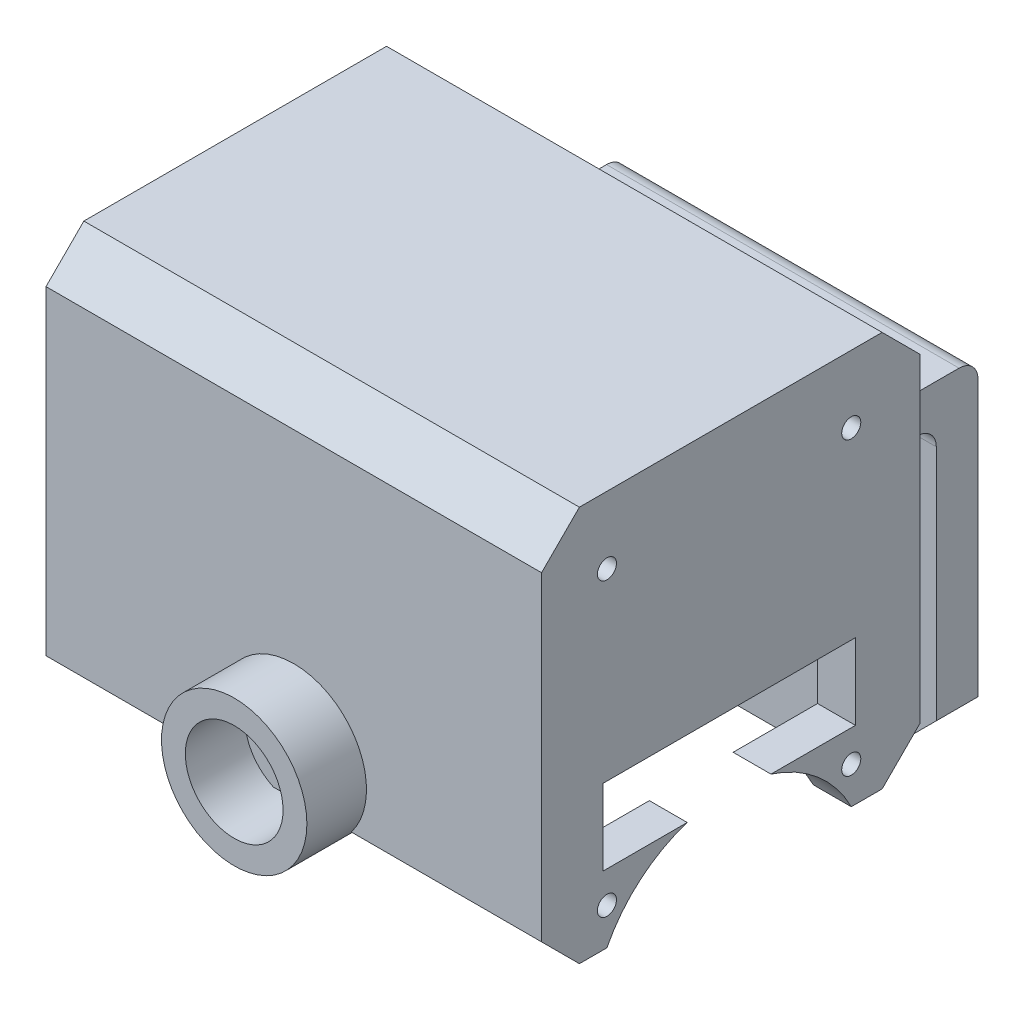
from build123d import *

# Parameters (mm, degrees)
SKETCH1_W                       = 25
SKETCH1_H                       = 30
BOSS_EXTRUDE1_DEPTH             = 3.175
SKETCH2_W                       = 25
SKETCH2_H                       = 3.175
BOSS_EXTRUDE2_DEPTH             = 41.58
SKETCH3_W                       = 3.175
SKETCH3_H                       = 25
BOSS_EXTRUDE3_DEPTH             = 30
CUT_EXTRUDE1_REACH              = 60.775
SKETCH4_R                       = 11.5
CUT_EXTRUDE2_REACH              = 60.775
SKETCH5_R                       = 0.8
CUT_EXTRUDE3_REACH              = 60.775
SKETCH6_R                       = 0.8
SKETCH6_R_2                     = 0.799851166
SKETCH6_W                       = 21.2
SKETCH6_H                       = 6.375
CUT_EXTRUDE4_REACH              = 60.775
SKETCH7_R                       = 11.5
BOSS_EXTRUDE4_DEPTH             = 0.2
SKETCH9_W                       = 41.58
SKETCH9_H                       = 33.175
BOSS_EXTRUDE5_DEPTH             = 3.175
BOSS_EXTRUDE6_DEPTH             = 0.2
SKETCH11_W                      = 41.58
SKETCH11_H                      = 33.175
BOSS_EXTRUDE7_DEPTH             = 3.175
CHAMFER1_SIZE                   = 3.175
CHAMFER2_SIZE                   = 3.175
SKETCH13_W                      = 29.58
SKETCH13_H                      = 3.175
BOSS_EXTRUDE8_DEPTH             = 7.695
BOSS_EXTRUDE9_REACH             = 59.968
SKETCH14_W                      = 29.58
SKETCH14_H                      = 3.5
BOSS_EXTRUDE9_DIRECTION_2_DEPTH = 25
CHAMFER3_SIZE                   = 3.5
FILLET1_R                       = 1.5875
FILLET2_R                       = 1.5875
CUT_EXTRUDE5_REACH              = 70.161
SKETCH16_R                      = 7.1
SKETCH20_R                      = 8
SKETCH20_R_2                    = 4.1
BOSS_EXTRUDE11_DEPTH            = 5
CUT_EXTRUDE6_START              = -21.7275
SKETCH21_R                      = 1.025
CUT_EXTRUDE6_DEPTH              = 16
BOSS_EXTRUDE12_DEPTH            = 5
BOSS_EXTRUDE12_DEPTH_BACK       = 1.2
SKETCH23_R                      = 6.1
SKETCH23_R_2                    = 4.1
CHAMFER4_SIZE                   = 1.5
SKETCH24_R                      = 11.5
SKETCH24_R_2                    = 10
BOSS_EXTRUDE13_DEPTH            = 1.8


with BuildPart() as part:
    # Sketch1 → Boss-Extrude1 (new body)
    with BuildSketch(Plane(origin=(0, 0, 0), x_dir=(0, 0, -1), z_dir=(1, 0, 0))):
        with Locations((12.5, 15)):
            Rectangle(SKETCH1_W, SKETCH1_H)
    extrude(amount=BOSS_EXTRUDE1_DEPTH)

    # Sketch2 → Boss-Extrude2 (add)
    with BuildSketch(Plane.ZY):
        with Locations((-12.5, 31.5875)):
            Rectangle(SKETCH2_W, SKETCH2_H)
    extrude(amount=-BOSS_EXTRUDE2_DEPTH)

    # Sketch3 → Boss-Extrude3 (add)
    with BuildSketch(Plane.XZ.offset(-30)):
        with Locations((39.9925, -12.5)):
            Rectangle(SKETCH3_W, SKETCH3_H)
    extrude(amount=BOSS_EXTRUDE3_DEPTH)

    # Sketch4 → Cut-Extrude1 (cut, up to next)
    with BuildSketch(Plane.ZY, mode=Mode.PRIVATE) as cut_extrude1_sk1:
        with Locations((-12.359999929, -5.209996254)):
            Circle(SKETCH4_R)
    cut_extrude1_tool1 = extrude(cut_extrude1_sk1.sketch, amount=-CUT_EXTRUDE1_REACH, mode=Mode.PRIVATE) & part.part
    add(cut_extrude1_tool1.solids().sort_by_distance((0, -5.209996, -12.36))[0], mode=Mode.SUBTRACT)

    # Sketch5 → Cut-Extrude2 (cut, up to next)
    with BuildSketch(Plane.ZY, mode=Mode.PRIVATE) as cut_extrude2_sk1:
        with Locations((-22.609999929, 3.090003746)):
            Circle(SKETCH5_R)
    cut_extrude2_tool1 = extrude(cut_extrude2_sk1.sketch, amount=-CUT_EXTRUDE2_REACH, mode=Mode.PRIVATE) & part.part
    # Sketch5 → Cut-Extrude2 (cut, up to next)
    with BuildSketch(Plane.ZY, mode=Mode.PRIVATE) as cut_extrude2_sk2:
        with Locations((-22.609999929, 23.790003746)):
            Circle(SKETCH5_R)
    cut_extrude2_tool2 = extrude(cut_extrude2_sk2.sketch, amount=-CUT_EXTRUDE2_REACH, mode=Mode.PRIVATE) & part.part
    # Sketch5 → Cut-Extrude2 (cut, up to next)
    with BuildSketch(Plane.ZY, mode=Mode.PRIVATE) as cut_extrude2_sk3:
        with Locations((-2.109999929, 23.790003746)):
            Circle(SKETCH5_R)
    cut_extrude2_tool3 = extrude(cut_extrude2_sk3.sketch, amount=-CUT_EXTRUDE2_REACH, mode=Mode.PRIVATE) & part.part
    # Sketch5 → Cut-Extrude2 (cut, up to next)
    with BuildSketch(Plane.ZY, mode=Mode.PRIVATE) as cut_extrude2_sk4:
        with Locations((-2.109999929, 3.090003746)):
            Circle(SKETCH5_R)
    cut_extrude2_tool4 = extrude(cut_extrude2_sk4.sketch, amount=-CUT_EXTRUDE2_REACH, mode=Mode.PRIVATE) & part.part
    add(cut_extrude2_tool1.solids().sort_by_distance((0, 3.090004, -22.61))[0], mode=Mode.SUBTRACT)
    add(cut_extrude2_tool2.solids().sort_by_distance((0, 23.790004, -22.61))[0], mode=Mode.SUBTRACT)
    add(cut_extrude2_tool3.solids().sort_by_distance((0, 23.790004, -2.11))[0], mode=Mode.SUBTRACT)
    add(cut_extrude2_tool4.solids().sort_by_distance((0, 3.090004, -2.11))[0], mode=Mode.SUBTRACT)

    # Sketch6 → Cut-Extrude3 (cut, up to next)
    with BuildSketch(Plane(origin=(41.58, 0, 0), x_dir=(0, 0, -1), z_dir=(1, 0, 0)), mode=Mode.PRIVATE) as cut_extrude3_sk1:
        with Locations(Location((2.109999929, 3.090003746, 0), (0, 0, 180))):
            Circle(SKETCH6_R)
    cut_extrude3_tool1 = extrude(cut_extrude3_sk1.sketch, amount=-CUT_EXTRUDE3_REACH, mode=Mode.PRIVATE) & part.part
    # Sketch6 → Cut-Extrude3 (cut, up to next)
    with BuildSketch(Plane(origin=(41.58, 0, 0), x_dir=(0, 0, -1), z_dir=(1, 0, 0)), mode=Mode.PRIVATE) as cut_extrude3_sk2:
        with Locations(Location((22.609999929, 3.090003746, 0), (0, 0, 180))):
            Circle(SKETCH6_R)
    cut_extrude3_tool2 = extrude(cut_extrude3_sk2.sketch, amount=-CUT_EXTRUDE3_REACH, mode=Mode.PRIVATE) & part.part
    # Sketch6 → Cut-Extrude3 (cut, up to next)
    with BuildSketch(Plane(origin=(41.58, 0, 0), x_dir=(0, 0, -1), z_dir=(1, 0, 0)), mode=Mode.PRIVATE) as cut_extrude3_sk3:
        with Locations((22.609999929, 27.540003746)):
            Circle(SKETCH6_R_2)
    cut_extrude3_tool3 = extrude(cut_extrude3_sk3.sketch, amount=-CUT_EXTRUDE3_REACH, mode=Mode.PRIVATE) & part.part
    # Sketch6 → Cut-Extrude3 (cut, up to next)
    with BuildSketch(Plane(origin=(41.58, 0, 0), x_dir=(0, 0, -1), z_dir=(1, 0, 0)), mode=Mode.PRIVATE) as cut_extrude3_sk4:
        with Locations((2.109999929, 27.540003746)):
            Circle(SKETCH6_R)
    cut_extrude3_tool4 = extrude(cut_extrude3_sk4.sketch, amount=-CUT_EXTRUDE3_REACH, mode=Mode.PRIVATE) & part.part
    # Sketch6 → Cut-Extrude3 (cut, up to next)
    with BuildSketch(Plane(origin=(41.58, 0, 0), x_dir=(0, 0, -1), z_dir=(1, 0, 0)), mode=Mode.PRIVATE) as cut_extrude3_sk5:
        with Locations((12.359999929, 8.927503746)):
            Rectangle(SKETCH6_W, SKETCH6_H)
    cut_extrude3_tool5 = extrude(cut_extrude3_sk5.sketch, amount=-CUT_EXTRUDE3_REACH, mode=Mode.PRIVATE) & part.part
    add(cut_extrude3_tool1.solids().sort_by_distance((41.58, 3.090004, -2.11))[0], mode=Mode.SUBTRACT)
    add(cut_extrude3_tool2.solids().sort_by_distance((41.58, 3.090004, -22.61))[0], mode=Mode.SUBTRACT)
    add(cut_extrude3_tool3.solids().sort_by_distance((41.58, 27.540004, -22.61))[0], mode=Mode.SUBTRACT)
    add(cut_extrude3_tool4.solids().sort_by_distance((41.58, 27.540004, -2.11))[0], mode=Mode.SUBTRACT)
    add(cut_extrude3_tool5.solids().sort_by_distance((41.58, 8.927504, -12.36))[0], mode=Mode.SUBTRACT)

    # Sketch7 → Cut-Extrude4 (cut, up to next)
    with BuildSketch(Plane(origin=(41.58, 0, 0), x_dir=(0, 0, -1), z_dir=(1, 0, 0)), mode=Mode.PRIVATE) as cut_extrude4_sk1:
        with Locations((12.359999929, -5.209996254)):
            Circle(SKETCH7_R)
    cut_extrude4_tool1 = extrude(cut_extrude4_sk1.sketch, amount=-CUT_EXTRUDE4_REACH, mode=Mode.PRIVATE) & part.part
    add(cut_extrude4_tool1.solids().sort_by_distance((41.58, -5.209996, -12.36))[0], mode=Mode.SUBTRACT)

    # Sketch8 → Boss-Extrude4 (add)
    with BuildSketch(Plane.XY):
        Polygon((0, 33.175), (0, 0), (3.175, 0), (3.175, 30), (38.405, 30), (38.405, 0), (41.58, 0), (41.58, 33.175), align=None)
    extrude(amount=BOSS_EXTRUDE4_DEPTH)

    # Sketch9 → Boss-Extrude5 (add)
    with BuildSketch(Plane.XY.offset(0.2)):
        with Locations((20.79, 16.5875)):
            Rectangle(SKETCH9_W, SKETCH9_H)
    extrude(amount=BOSS_EXTRUDE5_DEPTH)

    # Sketch10 → Boss-Extrude6 (add)
    with BuildSketch(Plane(origin=(0, 0, -25), x_dir=(-1, 0, 0), z_dir=(0, 0, -1))):
        Polygon((0, 0), (0, 33.175), (-41.58, 33.175), (-41.58, 0), (-38.405, 0), (-38.405, 30), (-3.175, 30), (-3.175, 0), align=None)
    extrude(amount=BOSS_EXTRUDE6_DEPTH)

    # Sketch11 → Boss-Extrude7 (add)
    with BuildSketch(Plane(origin=(0, 0, -25.2), x_dir=(-1, 0, 0), z_dir=(0, 0, -1))):
        with Locations((-20.79, 16.5875)):
            Rectangle(SKETCH11_W, SKETCH11_H)
    extrude(amount=BOSS_EXTRUDE7_DEPTH)

    # Chamfer1
    chamfer1_edges = [part.edges().sort_by_distance(p)[0] for p in [
        (20.79, 33.175, 3.375),
        (20.79, 33.175, -28.375),
    ]]
    chamfer(chamfer1_edges, length=CHAMFER1_SIZE)

    # Chamfer2
    chamfer2_edges = [part.edges().sort_by_distance(p)[0] for p in [
        (20.79, 0, 3.375),
        (20.79, 0, -28.375),
    ]]
    chamfer(chamfer2_edges, length=CHAMFER2_SIZE - 0.0001)  # a hair under: the kernel refuses the full size

    # Sketch13 → Boss-Extrude8 (add)
    with BuildSketch(Plane(origin=(0, 0, -28.375), x_dir=(-1, 0, 0), z_dir=(0, 0, -1))):
        with Locations((-20.79, 19.7625)):
            Rectangle(SKETCH13_W, SKETCH13_H)
    extrude(amount=BOSS_EXTRUDE8_DEPTH)

    # Boss-Extrude9: up to this face of the body (flat: up to its plane)
    boss_extrude9_end = Plane(part.part.faces().sort_by_distance((20.79, 21.35, -32.2225))[0])
    # Sketch14 → Boss-Extrude9 (add, up to the picked face)
    with BuildSketch(Plane.XZ.offset(-18.175), mode=Mode.PRIVATE) as boss_extrude9_sk1:
        with Locations((20.79, -37.495)):
            Rectangle(SKETCH14_W, SKETCH14_H)
    boss_extrude9_tool1 = split(extrude(boss_extrude9_sk1.sketch, amount=-BOSS_EXTRUDE9_REACH, mode=Mode.PRIVATE), bisect_by=boss_extrude9_end, keep=Keep.BOTH, mode=Mode.PRIVATE)
    add(boss_extrude9_tool1.solids().sort_by(Axis((20.79, 18.175, -37.495), (0, 1, 0)))[0])

    # Sketch14 → Boss-Extrude9 direction 2 (add)
    with BuildSketch(Plane.XZ.offset(-18.175)):
        with Locations((20.79, -37.495)):
            Rectangle(SKETCH14_W, SKETCH14_H)
    extrude(amount=BOSS_EXTRUDE9_DIRECTION_2_DEPTH)

    # Chamfer3
    chamfer3_edges = [part.edges().sort_by_distance(p)[0] for p in [
        (6, -6.825, -37.495),
        (35.58, -6.825, -37.495),
    ]]
    chamfer(chamfer3_edges, length=CHAMFER3_SIZE)

    # Fillet1
    fillet1_edges = [part.edges().sort_by_distance(p)[0] for p in [
        (20.79, 18.175, -35.745),
        (20.79, 21.35, -39.245),
    ]]
    fillet(fillet1_edges, radius=FILLET1_R)

    # Fillet2
    fillet2_edges = [part.edges().sort_by_distance(p)[0] for p in [
        (20.79, 21.35, -28.375),
    ]]
    fillet(fillet2_edges, radius=FILLET2_R)

    # Sketch16 → Cut-Extrude5 (cut, up to next)
    with BuildSketch(Plane(origin=(0, 0, -39.245), x_dir=(-1, 0, 0), z_dir=(0, 0, -1)), mode=Mode.PRIVATE) as cut_extrude5_sk1:
        with Locations((-20.79, 6.9025)):
            Circle(SKETCH16_R)
    cut_extrude5_tool1 = extrude(cut_extrude5_sk1.sketch, amount=-CUT_EXTRUDE5_REACH, mode=Mode.PRIVATE) & part.part
    add(cut_extrude5_tool1.solids().sort_by_distance((20.79, 6.9025, -39.245))[0], mode=Mode.SUBTRACT)

    # Sketch20 → Boss-Extrude11 (add)
    with BuildSketch(Plane.XY.offset(-35.745)):
        with Locations(Location((20.79, 6.9025, 0), (0, 0, 180))):
            Circle(SKETCH20_R)
        with Locations((20.79, 6.9025)):
            Circle(SKETCH20_R_2, mode=Mode.SUBTRACT)
    extrude(amount=BOSS_EXTRUDE11_DEPTH)

    # Sketch21 → Cut-Extrude6 (cut)
    with BuildSketch(Plane.XZ.offset(6.825).offset(CUT_EXTRUDE6_START)):
        with Locations(Location((20.79, -33.245, 0), (0, 0, 270))):
            Circle(SKETCH21_R)
    extrude(amount=CUT_EXTRUDE6_DEPTH, mode=Mode.SUBTRACT)

    # Sketch23 → Boss-Extrude12 (add, two sides: drawn at the far end of the back side and taken through both)
    with BuildSketch(Plane.XY.offset(3.375).offset(-BOSS_EXTRUDE12_DEPTH_BACK)):
        with Locations(Location((20.79, 6.9025, 0), (0, 0, 217.666590828))):
            Circle(SKETCH23_R)
        with Locations((20.79, 6.9025)):
            Circle(SKETCH23_R_2, mode=Mode.SUBTRACT)
    extrude(amount=BOSS_EXTRUDE12_DEPTH + BOSS_EXTRUDE12_DEPTH_BACK)

    # Chamfer4
    chamfer4_edges = [part.edges().sort_by_distance(p)[0] for p in [
        (35.58, 20.55625, -28.375),
        (20.79, 18.175, -28.375),
        (6, 20.55625, -28.375),
    ]]
    chamfer(chamfer4_edges, length=CHAMFER4_SIZE)

    # Sketch24 → Boss-Extrude13 (add)
    with BuildSketch(Plane(origin=(0, 0, -39.245), x_dir=(-1, 0, 0), z_dir=(0, 0, -1))):
        with Locations(Location((-20.79, 6.9025, 0), (0, 0, 180))):
            Circle(SKETCH24_R)
        with Locations((-20.79, 6.9025)):
            Circle(SKETCH24_R_2, mode=Mode.SUBTRACT)
    extrude(amount=BOSS_EXTRUDE13_DEPTH)


solid = part.part
